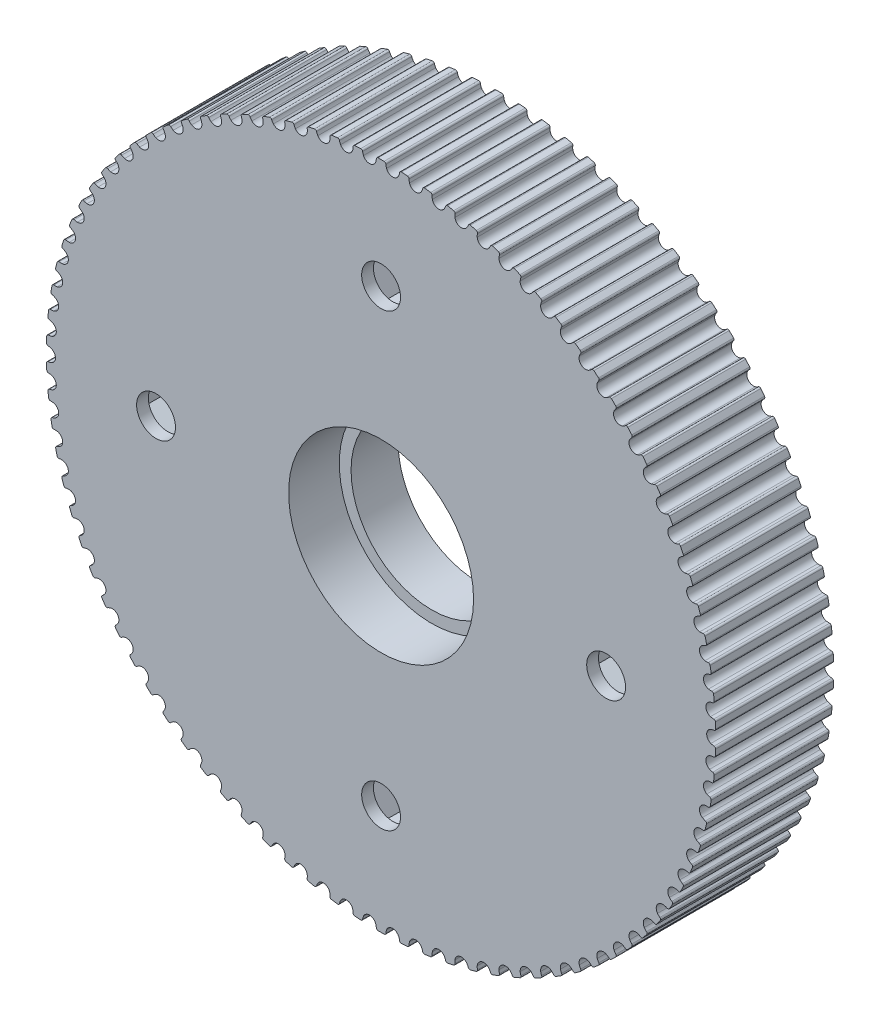
from build123d import *

# Parameters (mm, degrees)
EXTRUDE_1_DEPTH     = 10
SKETCH_7_R          = 6.85
SKETCH_7_R_2        = 1.65
CUT_EXTRUDE_2_DEPTH = 42.389606088
SKETCH_8_R          = 7.85
CUT_EXTRUDE_3_DEPTH = 4.3
CUT_EXTRUDE_4_DEPTH = 9


with BuildPart() as part:
    # 草图5 → 凸台-拉伸1 (new body)
    with BuildSketch(Plane.XY):
        with BuildLine():
            Line((-10.005707242, 26.144812388), (-10.005672259, 26.138581073))
            ThreePointArc((-10.005672259, 26.138581073), (-10.355657709, 25.622834978), (-10.964209319, 25.757552411))
            ThreePointArc((-10.964209319, 25.757552411), (-11.052436124, 25.865080775), (-11.124889477, 25.983810847))
            ThreePointArc((-11.124889477, 25.983810847), (-11.207844336, 26.056115388), (-11.317822781, 26.052347527))
            ThreePointArc((-11.317822781, 26.052347527), (-11.553167651, 25.9488394), (-11.787565636, 25.843204533))
            ThreePointArc((-11.787565636, 25.843204533), (-11.863955647, 25.763995812), (-11.865730536, 25.653967156))
            ThreePointArc((-11.865730536, 25.653967156), (-11.825977654, 25.520677898), (-11.805103762, 25.383162085))
            ThreePointArc((-11.805103762, 25.383162085), (-11.803737806, 25.360716271), (-11.803282238, 25.338233546))
            ThreePointArc((-11.803282238, 25.338233546), (-12.135393298, 24.829956535), (-12.734257086, 24.929983729))
            ThreePointArc((-12.734257086, 24.929983729), (-12.829769774, 25.031095769), (-12.910328825, 25.144482529))
            ThreePointArc((-12.910328825, 25.144482529), (-12.99812532, 25.210824302), (-13.107573031, 25.19939391))
            ThreePointArc((-13.107573031, 25.19939391), (-13.33512425, 25.079721095), (-13.561582537, 24.957992773))
            ThreePointArc((-13.561582537, 24.957992773), (-13.632261144, 24.873648303), (-13.626356498, 24.763763861))
            ThreePointArc((-13.626356498, 24.763763861), (-13.577402664, 24.633572309), (-13.546987001, 24.497847567))
            ThreePointArc((-13.546987001, 24.497847567), (-13.542261923, 24.456263043), (-13.540683906, 24.414440693))
            ThreePointArc((-13.540683906, 24.414440693), (-13.855192132, 23.914252022), (-14.44226483, 23.980958671))
            ThreePointArc((-14.44226483, 23.980958671), (-14.544598074, 24.075161779), (-14.632870348, 24.18265282))
            ThreePointArc((-14.632870348, 24.18265282), (-14.725080743, 24.242708613), (-14.8334645, 24.223671379))
            ThreePointArc((-14.8334645, 24.223671379), (-15.052113463, 24.08841691), (-15.26952877, 23.951188181))
            ThreePointArc((-15.26952877, 23.951188181), (-15.334151635, 23.862118879), (-15.320596222, 23.752913998))
            ThreePointArc((-15.320596222, 23.752913998), (-15.262679933, 23.626454433), (-15.222870682, 23.493181998))
            ThreePointArc((-15.222870682, 23.493181998), (-15.212787545, 23.432814159), (-15.209412819, 23.371703138))
            ThreePointArc((-15.209412819, 23.371703138), (-15.506611214, 22.88021221), (-16.079911313, 22.915100794))
            ThreePointArc((-16.079911313, 22.915100794), (-16.188566555, 23.001936021), (-16.284121998, 23.103007656))
            ThreePointArc((-16.284121998, 23.103007656), (-16.380297053, 23.156484885), (-16.487088824, 23.129933556))
            ThreePointArc((-16.487088824, 23.129933556), (-16.695770293, 22.97975638), (-16.903083396, 22.827695808))
            ThreePointArc((-16.903083396, 22.827695808), (-16.961335683, 22.734335611), (-16.940195542, 22.626342325))
            ThreePointArc((-16.940195542, 22.626342325), (-16.873598961, 22.504230845), (-16.824590068, 22.374060009))
            ThreePointArc((-16.824590068, 22.374060009), (-16.807182604, 22.295426233), (-16.801339099, 22.215100995))
            ThreePointArc((-16.801339099, 22.215100995), (-17.081541753, 21.732906616), (-17.639218085, 21.737602849))
            ThreePointArc((-17.639218085, 21.737602849), (-17.753665967, 21.816647143), (-17.856039043, 21.910806962))
            ThreePointArc((-17.856039043, 21.910806962), (-17.955710203, 21.95744509), (-18.060389707, 21.923509021))
            ThreePointArc((-18.060389707, 21.923509021), (-18.258087009, 21.759140786), (-18.454287898, 21.592989195))
            ThreePointArc((-18.454287898, 21.592989195), (-18.505885806, 21.495792944), (-18.477263931, 21.389537387))
            ThreePointArc((-18.477263931, 21.389537387), (-18.402311509, 21.272368907), (-18.344341741, 21.145933848))
            ThreePointArc((-18.344341741, 21.145933848), (-18.317688385, 21.049710704), (-18.308707038, 20.950269113))
            ThreePointArc((-18.308707038, 20.950269113), (-18.572248749, 20.477958763), (-19.112588357, 20.454201487))
            ThreePointArc((-19.112588357, 20.454201487), (-19.232271302, 20.525069753), (-19.340963259, 20.611859019))
            ThreePointArc((-19.340963259, 20.611859019), (-19.443644937, 20.65143083), (-19.545702186, 20.610275354))
            ThreePointArc((-19.545702186, 20.610275354), (-19.731452159, 20.432516845), (-19.915584963, 20.253083709))
            ThreePointArc((-19.915584963, 20.253083709), (-19.960277115, 20.152524935), (-19.924312948, 20.048524772))
            ThreePointArc((-19.924312948, 20.048524772), (-19.841369847, 19.936870125), (-19.774721627, 19.814786822))
            ThreePointArc((-19.774721627, 19.814786822), (-19.736957321, 19.701806415), (-19.724172893, 19.583369624))
            ThreePointArc((-19.724172893, 19.583369624), (-19.97140876, 19.121518741), (-20.492844022, 19.071149312))
            ThreePointArc((-20.492844022, 19.071149312), (-20.617178945, 19.133496286), (-20.731660247, 19.21249217))
            ThreePointArc((-20.731660247, 19.21249217), (-20.836852188, 19.244804874), (-20.935789969, 19.196630498))
            ThreePointArc((-20.935789969, 19.196630498), (-21.108687658, 19.006347736), (-21.279855301, 18.814507235))
            ThreePointArc((-21.279855301, 18.814507235), (-21.317423959, 18.711075851), (-21.274292715, 18.60983776))
            ThreePointArc((-21.274292715, 18.60983776), (-21.183763024, 18.504240916), (-21.108761055, 18.387104147))
            ThreePointArc((-21.108761055, 18.387104147), (-21.058088772, 18.258349622), (-21.040840656, 18.121061929))
            ThreePointArc((-21.040840656, 18.121061929), (-21.272145641, 17.670233206), (-21.773260611, 17.595184414))
            ThreePointArc((-21.773260611, 17.595184414), (-21.901641765, 17.648706349), (-22.021354671, 17.71952399))
            ThreePointArc((-22.021354671, 17.71952399), (-22.12854439, 17.744420164), (-22.22388069, 17.689461587))
            ThreePointArc((-22.22388069, 17.689461587), (-22.383083754, 17.487581612), (-22.540452324, 17.284268373))
            ThreePointArc((-22.540452324, 17.284268373), (-22.570714458, 17.178468285), (-22.520626267, 17.080485489))
            ThreePointArc((-22.520626267, 17.080485489), (-22.422951039, 16.981460906), (-22.339960723, 16.869841349))
            ThreePointArc((-22.339960723, 16.869841349), (-22.274662626, 16.726441571), (-22.252295656, 16.570470241))
            ThreePointArc((-22.252295656, 16.570470241), (-22.468064131, 16.131212943), (-22.947600063, 16.033497547))
            ThreePointArc((-22.947600063, 16.033497547), (-23.079401989, 16.077933688), (-23.203763269, 16.140228071))
            ThreePointArc((-23.203763269, 16.140228071), (-23.312428548, 16.157586423), (-23.403698897, 16.096111398))
            ThreePointArc((-23.403698897, 16.096111398), (-23.548431715, 15.883617748), (-23.691234529, 15.669822293))
            ThreePointArc((-23.691234529, 15.669822293), (-23.714042705, 15.562168949), (-23.657241592, 15.46791881))
            ThreePointArc((-23.657241592, 15.46791881), (-23.55289669, 15.375948926), (-23.462322347, 15.27039038))
            ThreePointArc((-23.462322347, 15.27039038), (-23.38077056, 15.11361383), (-23.352635803, 14.939148888))
            ThreePointArc((-23.352635803, 14.939148888), (-23.553281071, 14.511998184), (-24.010141114, 14.393697092))
            ThreePointArc((-24.010141114, 14.393697092), (-24.144721685, 14.428830951), (-24.273125463, 14.482298584))
            ThreePointArc((-24.273125463, 14.482298584), (-24.382736897, 14.492034544), (-24.469496635, 14.424342572))
            ThreePointArc((-24.469496635, 14.424342572), (-24.599054084, 14.202270495), (-24.72659542, 13.979034415))
            ThreePointArc((-24.72659542, 13.979034415), (-24.741838519, 13.870052291), (-24.678601213, 13.779993985))
            ThreePointArc((-24.678601213, 13.779993985), (-24.568094995, 13.695526867), (-24.470377895, 13.596543603))
            ThreePointArc((-24.470377895, 13.596543603), (-24.371044799, 13.427791497), (-24.336500351, 13.235045502))
            ThreePointArc((-24.336500351, 13.235045502), (-24.522454138, 12.820521809), (-24.955707171, 12.68377199))
            ThreePointArc((-24.955707171, 12.68377199), (-25.092410725, 12.709432399), (-25.224231432, 12.753812793))
            ThreePointArc((-25.224231432, 12.753812793), (-25.334255003, 12.75587893), (-25.416081446, 12.682299798))
            ThreePointArc((-25.416081446, 12.682299798), (-25.529832334, 12.451731206), (-25.641490824, 12.220142084))
            ThreePointArc((-25.641490824, 12.220142084), (-25.649094583, 12.110362131), (-25.57972917, 12.024934414))
            ThreePointArc((-25.57972917, 12.024934414), (-25.463600012, 11.948381578), (-25.359216222, 11.856455833))
            ThreePointArc((-25.359216222, 11.856455833), (-25.240684245, 11.677254521), (-25.199096012, 11.466462305))
            ThreePointArc((-25.199096012, 11.466462305), (-25.370807943, 11.065070656), (-25.779691531, 10.912052827))
            ThreePointArc((-25.779691531, 10.912052827), (-25.917852061, 10.928114771), (-26.052447479, 10.963191708))
            ThreePointArc((-26.052447479, 10.963191708), (-26.162347165, 10.957577956), (-26.238841661, 10.878470135))
            ThreePointArc((-26.238841661, 10.878470135), (-26.336231806, 10.640528336), (-26.431463461, 10.401714451))
            ThreePointArc((-26.431463461, 10.401714451), (-26.431390835, 10.291671505), (-26.356235257, 10.211290572))
            ThreePointArc((-26.356235257, 10.211290572), (-26.235048928, 10.143024975), (-26.124506996, 10.058604602))
            ThreePointArc((-26.124506996, 10.058604602), (-25.985477837, 9.870597276), (-25.936220305, 9.642015657))
            ThreePointArc((-25.936220305, 9.642015657), (-26.094157358, 9.254245085), (-26.478079823, 9.087171239))
            ThreePointArc((-26.478079823, 9.087171239), (-26.617024226, 9.093556465), (-26.75373862, 9.119159055))
            ThreePointArc((-26.75373862, 9.119159055), (-26.862979001, 9.105892763), (-26.933768878, 9.021641659))
            ThreePointArc((-26.933768878, 9.021641659), (-27.014323804, 8.777485881), (-27.092664666, 8.53261071))
            ThreePointArc((-27.092664666, 8.53261071), (-27.084916008, 8.422840889), (-27.004336414, 8.347898348))
            ThreePointArc((-27.004336414, 8.347898348), (-26.878683321, 8.288252574), (-26.762521797, 8.21174886))
            ThreePointArc((-26.762521797, 8.21174886), (-26.601825035, 8.016686608), (-26.544282034, 7.770594077))
            ThreePointArc((-26.544282034, 7.770594077), (-26.68892797, 7.396917021), (-27.047469573, 7.218017866))
            ThreePointArc((-27.047469573, 7.218017866), (-27.186520925, 7.214695267), (-27.324688236, 7.230698776))
            ThreePointArc((-27.324688236, 7.230698776), (-27.432737103, 7.209844577), (-27.497477479, 7.120860652))
            ThreePointArc((-27.497477479, 7.120860652), (-27.560804732, 6.871680397), (-27.62187313, 6.621936947))
            ThreePointArc((-27.62187313, 6.621936947), (-27.606486193, 6.512975039), (-27.52087516, 6.443836003))
            ThreePointArc((-27.52087516, 6.443836003), (-27.391367473, 6.39310064), (-27.270152282, 6.324886303))
            ThreePointArc((-27.270152282, 6.324886303), (-27.086753331, 6.124618562), (-27.020318787, 5.861314945))
            ThreePointArc((-27.020318787, 5.861314945), (-27.152173558, 5.502186674), (-27.48508677, 5.313699037))
            ThreePointArc((-27.48508677, 5.313699037), (-27.623567627, 5.300684799), (-27.762514718, 5.30701126))
            ThreePointArc((-27.762514718, 5.30701126), (-27.868845668, 5.278670753), (-27.927221136, 5.185387527))
            ThreePointArc((-27.927221136, 5.185387527), (-27.973012191, 4.932396778), (-28.016510607, 4.679001774))
            ThreePointArc((-28.016510607, 4.679001774), (-27.993560353, 4.57137863), (-27.903334968, 4.508379937))
            ThreePointArc((-27.903334968, 4.508379937), (-27.770603635, 4.466802162), (-27.644925327, 4.407209536))
            ThreePointArc((-27.644925327, 4.407209536), (-27.437932688, 4.203673984), (-27.36201136, 3.923480076))
            ThreePointArc((-27.36201136, 3.923480076), (-27.481590504, 3.579338131), (-27.788799389, 3.383492399))
            ThreePointArc((-27.788799389, 3.383492399), (-27.926035087, 3.360849927), (-28.065085021, 3.357468518))
            ThreePointArc((-28.065085021, 3.357468518), (-28.16918002, 3.321779774), (-28.220906179, 3.224651716))
            ThreePointArc((-28.220906179, 3.224651716), (-28.248937946, 2.969083016), (-28.274654461, 2.713270974))
            ThreePointArc((-28.274654461, 2.713270974), (-28.244252701, 2.607510924), (-28.149852535, 2.550959497))
            ThreePointArc((-28.149852535, 2.550959497), (-28.014544209, 2.518741873), (-27.885015076, 2.468061287))
            ThreePointArc((-27.885015076, 2.468061287), (-27.653686855, 2.263273231), (-27.567695058, 1.966530405))
            ThreePointArc((-27.567695058, 1.966530405), (-27.675529068, 1.637794071), (-27.957127768, 1.436801727))
            ThreePointArc((-27.957127768, 1.436801727), (-28.092449707, 1.404641332), (-28.230925048, 1.391568527))
            ThreePointArc((-28.230925048, 1.391568527), (-28.332276956, 1.348705419), (-28.377101802, 1.248205724))
            ThreePointArc((-28.377101802, 1.248205724), (-28.387237714, 0.99130418), (-28.395047038, 0.73432139))
            ThreePointArc((-28.395047038, 0.73432139), (-28.357341888, 0.630939685), (-28.259226847, 0.581111038))
            ThreePointArc((-28.259226847, 0.581111038), (-28.122000739, 0.558410527), (-27.989251833, 0.516888892))
            ThreePointArc((-27.989251833, 0.516888892), (-27.733001492, 0.312930204), (-27.636367813, -4e-09))
            ThreePointArc((-27.636367813, -4e-09), (-27.733001492, -0.312930213), (-27.989251833, -0.5168889))
            ThreePointArc((-27.989251833, -0.5168889), (-28.122000739, -0.558410535), (-28.259226847, -0.581111046))
            ThreePointArc((-28.259226847, -0.581111046), (-28.357341888, -0.630939694), (-28.395047039, -0.734321399))
            ThreePointArc((-28.395047039, -0.734321399), (-28.387237715, -0.991304189), (-28.377101803, -1.248205733))
            ThreePointArc((-28.377101803, -1.248205733), (-28.332276957, -1.348705427), (-28.230925049, -1.391568535))
            ThreePointArc((-28.230925049, -1.391568535), (-28.092449708, -1.40464134), (-27.957127769, -1.436801734))
            ThreePointArc((-27.957127769, -1.436801734), (-27.675529068, -1.637794079), (-27.567695058, -1.966530413))
            ThreePointArc((-27.567695058, -1.966530413), (-27.653686854, -2.263273239), (-27.885015075, -2.468061295))
            ThreePointArc((-27.885015075, -2.468061295), (-28.014544209, -2.518741881), (-28.149852534, -2.550959504))
            ThreePointArc((-28.149852534, -2.550959504), (-28.2442527, -2.607510932), (-28.27465446, -2.713270983))
            ThreePointArc((-28.27465446, -2.713270983), (-28.248937945, -2.969083025), (-28.220906178, -3.224651724))
            ThreePointArc((-28.220906178, -3.224651724), (-28.169180019, -3.321779782), (-28.06508502, -3.357468527))
            ThreePointArc((-28.06508502, -3.357468527), (-27.926035086, -3.360849935), (-27.788799388, -3.383492407))
            ThreePointArc((-27.788799388, -3.383492407), (-27.481590503, -3.579338139), (-27.362011359, -3.923480083))
            ThreePointArc((-27.362011359, -3.923480083), (-27.437932687, -4.203673992), (-27.644925327, -4.407209544))
            ThreePointArc((-27.644925327, -4.407209544), (-27.770603635, -4.46680217), (-27.903334968, -4.508379945))
            ThreePointArc((-27.903334968, -4.508379945), (-27.993560353, -4.571378638), (-28.016510607, -4.679001782))
            ThreePointArc((-28.016510607, -4.679001782), (-27.973012191, -4.932396785), (-27.927221136, -5.185387535))
            ThreePointArc((-27.927221136, -5.185387535), (-27.868845669, -5.278670761), (-27.762514718, -5.307011269))
            ThreePointArc((-27.762514718, -5.307011269), (-27.623567627, -5.300684807), (-27.48508677, -5.313699045))
            ThreePointArc((-27.48508677, -5.313699045), (-27.152173558, -5.502186682), (-27.020318787, -5.861314953))
            ThreePointArc((-27.020318787, -5.861314953), (-27.086753331, -6.124618571), (-27.270152282, -6.324886311))
            ThreePointArc((-27.270152282, -6.324886311), (-27.391367473, -6.393100648), (-27.520875161, -6.443836012))
            ThreePointArc((-27.520875161, -6.443836012), (-27.606486194, -6.512975048), (-27.621873131, -6.621936956))
            ThreePointArc((-27.621873131, -6.621936956), (-27.560804733, -6.871680405), (-27.49747748, -7.120860659))
            ThreePointArc((-27.49747748, -7.120860659), (-27.432737103, -7.209844584), (-27.324688236, -7.230698784))
            ThreePointArc((-27.324688236, -7.230698784), (-27.186520925, -7.214695274), (-27.047469573, -7.218017874))
            ThreePointArc((-27.047469573, -7.218017874), (-26.68892797, -7.396917029), (-26.544282034, -7.770594085))
            ThreePointArc((-26.544282034, -7.770594085), (-26.601825035, -8.016686616), (-26.762521796, -8.211748867))
            ThreePointArc((-26.762521796, -8.211748867), (-26.87868332, -8.288252582), (-27.004336413, -8.347898355))
            ThreePointArc((-27.004336413, -8.347898355), (-27.084916007, -8.422840896), (-27.092664664, -8.532610717))
            ThreePointArc((-27.092664664, -8.532610717), (-27.014323803, -8.777485889), (-26.933768877, -9.021641667))
            ThreePointArc((-26.933768877, -9.021641667), (-26.862979, -9.105892771), (-26.753738619, -9.119159063))
            ThreePointArc((-26.753738619, -9.119159063), (-26.617024225, -9.093556473), (-26.478079822, -9.087171247))
            ThreePointArc((-26.478079822, -9.087171247), (-26.094157357, -9.254245093), (-25.936220303, -9.642015665))
            ThreePointArc((-25.936220303, -9.642015665), (-25.985477836, -9.870597284), (-26.124506994, -10.058604609))
            ThreePointArc((-26.124506994, -10.058604609), (-26.235048926, -10.143024983), (-26.356235256, -10.21129058))
            ThreePointArc((-26.356235256, -10.21129058), (-26.431390833, -10.291671512), (-26.43146346, -10.401714458))
            ThreePointArc((-26.43146346, -10.401714458), (-26.336231804, -10.640528343), (-26.23884166, -10.878470143))
            ThreePointArc((-26.23884166, -10.878470143), (-26.162347163, -10.957577963), (-26.052447477, -10.963191716))
            ThreePointArc((-26.052447477, -10.963191716), (-25.917852059, -10.928114778), (-25.779691529, -10.912052835))
            ThreePointArc((-25.779691529, -10.912052835), (-25.370807941, -11.065070663), (-25.19909601, -11.466462313))
            ThreePointArc((-25.19909601, -11.466462313), (-25.240684243, -11.677254528), (-25.35921622, -11.85645584))
            ThreePointArc((-25.35921622, -11.85645584), (-25.463600009, -11.948381585), (-25.579729168, -12.024934421))
            ThreePointArc((-25.579729168, -12.024934421), (-25.649094581, -12.110362138), (-25.641490822, -12.220142091))
            ThreePointArc((-25.641490822, -12.220142091), (-25.529832332, -12.451731214), (-25.416081444, -12.682299805))
            ThreePointArc((-25.416081444, -12.682299805), (-25.334255002, -12.755878937), (-25.22423143, -12.7538128))
            ThreePointArc((-25.22423143, -12.7538128), (-25.092410723, -12.709432406), (-24.955707169, -12.683771997))
            ThreePointArc((-24.955707169, -12.683771997), (-24.522454137, -12.820521815), (-24.33650035, -13.235045509))
            ThreePointArc((-24.33650035, -13.235045509), (-24.371044798, -13.427791503), (-24.470377894, -13.59654361))
            ThreePointArc((-24.470377894, -13.59654361), (-24.568094995, -13.695526873), (-24.678601212, -13.779993991))
            ThreePointArc((-24.678601212, -13.779993991), (-24.741838518, -13.870052297), (-24.726595419, -13.979034421))
            ThreePointArc((-24.726595419, -13.979034421), (-24.599054082, -14.202270501), (-24.469496634, -14.424342579))
            ThreePointArc((-24.469496634, -14.424342579), (-24.382736895, -14.492034551), (-24.273125462, -14.48229859))
            ThreePointArc((-24.273125462, -14.48229859), (-24.144721683, -14.428830957), (-24.010141112, -14.393697098))
            ThreePointArc((-24.010141112, -14.393697098), (-23.553281069, -14.51199819), (-23.352635801, -14.939148894))
            ThreePointArc((-23.352635801, -14.939148894), (-23.380770558, -15.113613836), (-23.462322345, -15.270390386))
            ThreePointArc((-23.462322345, -15.270390386), (-23.552896688, -15.375948932), (-23.65724159, -15.467918816))
            ThreePointArc((-23.65724159, -15.467918816), (-23.714042704, -15.562168956), (-23.691234528, -15.6698223))
            ThreePointArc((-23.691234528, -15.6698223), (-23.548431714, -15.883617755), (-23.403698896, -16.096111405))
            ThreePointArc((-23.403698896, -16.096111405), (-23.312428547, -16.15758643), (-23.203763268, -16.140228078))
            ThreePointArc((-23.203763268, -16.140228078), (-23.079401987, -16.077933695), (-22.947600062, -16.033497554))
            ThreePointArc((-22.947600062, -16.033497554), (-22.468064131, -16.13121295), (-22.252295655, -16.570470247))
            ThreePointArc((-22.252295655, -16.570470247), (-22.274662626, -16.726441578), (-22.339960722, -16.869841355))
            ThreePointArc((-22.339960722, -16.869841355), (-22.422951038, -16.981460912), (-22.520626267, -17.080485495))
            ThreePointArc((-22.520626267, -17.080485495), (-22.570714458, -17.178468291), (-22.540452324, -17.284268379))
            ThreePointArc((-22.540452324, -17.284268379), (-22.383083754, -17.487581618), (-22.22388069, -17.689461594))
            ThreePointArc((-22.22388069, -17.689461594), (-22.12854439, -17.744420171), (-22.021354671, -17.719523997))
            ThreePointArc((-22.021354671, -17.719523997), (-21.901641765, -17.648706355), (-21.773260611, -17.595184421))
            ThreePointArc((-21.773260611, -17.595184421), (-21.272145642, -17.670233212), (-21.040840657, -18.121061935))
            ThreePointArc((-21.040840657, -18.121061935), (-21.058088772, -18.258349627), (-21.108761055, -18.387104153))
            ThreePointArc((-21.108761055, -18.387104153), (-21.183763025, -18.504240922), (-21.274292715, -18.609837766))
            ThreePointArc((-21.274292715, -18.609837766), (-21.31742396, -18.711075857), (-21.279855301, -18.814507241))
            ThreePointArc((-21.279855301, -18.814507241), (-21.108687658, -19.006347742), (-20.93578997, -19.196630504))
            ThreePointArc((-20.93578997, -19.196630504), (-20.836852188, -19.24480488), (-20.731660248, -19.212492176))
            ThreePointArc((-20.731660248, -19.212492176), (-20.617178946, -19.133496292), (-20.492844023, -19.071149318))
            ThreePointArc((-20.492844023, -19.071149318), (-19.97140876, -19.121518747), (-19.724172894, -19.583369631))
            ThreePointArc((-19.724172894, -19.583369631), (-19.736957322, -19.701806421), (-19.774721627, -19.814786828))
            ThreePointArc((-19.774721627, -19.814786828), (-19.841369847, -19.936870131), (-19.924312948, -20.048524778))
            ThreePointArc((-19.924312948, -20.048524778), (-19.960277115, -20.152524942), (-19.915584963, -20.253083715))
            ThreePointArc((-19.915584963, -20.253083715), (-19.73145216, -20.432516851), (-19.545702187, -20.61027536))
            ThreePointArc((-19.545702187, -20.61027536), (-19.443644938, -20.651430836), (-19.34096326, -20.611859025))
            ThreePointArc((-19.34096326, -20.611859025), (-19.232271303, -20.525069759), (-19.112588358, -20.454201493))
            ThreePointArc((-19.112588358, -20.454201493), (-18.572248751, -20.477958769), (-18.308707039, -20.950269118))
            ThreePointArc((-18.308707039, -20.950269118), (-18.317688386, -21.04971071), (-18.344341743, -21.145933853))
            ThreePointArc((-18.344341743, -21.145933853), (-18.402311511, -21.272368913), (-18.477263932, -21.389537392))
            ThreePointArc((-18.477263932, -21.389537392), (-18.505885807, -21.49579295), (-18.454287899, -21.5929892))
            ThreePointArc((-18.454287899, -21.5929892), (-18.25808701, -21.759140792), (-18.060389708, -21.923509027))
            ThreePointArc((-18.060389708, -21.923509027), (-17.955710204, -21.957445096), (-17.856039044, -21.910806968))
            ThreePointArc((-17.856039044, -21.910806968), (-17.753665968, -21.816647149), (-17.639218086, -21.737602855))
            ThreePointArc((-17.639218086, -21.737602855), (-17.081541754, -21.732906622), (-16.8013391, -22.215101001))
            ThreePointArc((-16.8013391, -22.215101001), (-16.807182605, -22.295426239), (-16.824590069, -22.374060015))
            ThreePointArc((-16.824590069, -22.374060015), (-16.873598961, -22.504230851), (-16.940195543, -22.626342331))
            ThreePointArc((-16.940195543, -22.626342331), (-16.961335684, -22.734335616), (-16.903083397, -22.827695814))
            ThreePointArc((-16.903083397, -22.827695814), (-16.695770295, -22.979756386), (-16.487088825, -23.129933562))
            ThreePointArc((-16.487088825, -23.129933562), (-16.380297055, -23.156484891), (-16.284121999, -23.103007662))
            ThreePointArc((-16.284121999, -23.103007662), (-16.188566556, -23.001936027), (-16.079911315, -22.9151008))
            ThreePointArc((-16.079911315, -22.9151008), (-15.506611215, -22.880212216), (-15.209412821, -23.371703144))
            ThreePointArc((-15.209412821, -23.371703144), (-15.212787547, -23.432814165), (-15.222870684, -23.493182005))
            ThreePointArc((-15.222870684, -23.493182005), (-15.262679934, -23.626454439), (-15.320596223, -23.752914004))
            ThreePointArc((-15.320596223, -23.752914004), (-15.334151637, -23.862118885), (-15.269528772, -23.951188187))
            ThreePointArc((-15.269528772, -23.951188187), (-15.052113465, -24.088416917), (-14.833464502, -24.223671385))
            ThreePointArc((-14.833464502, -24.223671385), (-14.725080745, -24.24270862), (-14.63287035, -24.182652826))
            ThreePointArc((-14.63287035, -24.182652826), (-14.544598076, -24.075161786), (-14.442264832, -23.980958678))
            ThreePointArc((-14.442264832, -23.980958678), (-13.855192134, -23.914252029), (-13.540683908, -24.414440699))
            ThreePointArc((-13.540683908, -24.414440699), (-13.542261926, -24.456263049), (-13.546987004, -24.497847573))
            ThreePointArc((-13.546987004, -24.497847573), (-13.577402666, -24.633572316), (-13.626356501, -24.763763868))
            ThreePointArc((-13.626356501, -24.763763868), (-13.632261146, -24.87364831), (-13.561582538, -24.95799278))
            ThreePointArc((-13.561582538, -24.95799278), (-13.335124252, -25.079721102), (-13.107573032, -25.199393916))
            ThreePointArc((-13.107573032, -25.199393916), (-12.998125322, -25.210824308), (-12.910328827, -25.144482536))
            ThreePointArc((-12.910328827, -25.144482536), (-12.829769776, -25.031095775), (-12.734257088, -24.929983736))
            ThreePointArc((-12.734257088, -24.929983736), (-12.135393299, -24.829956542), (-11.80328224, -25.338233554))
            ThreePointArc((-11.80328224, -25.338233554), (-11.803737808, -25.360716277), (-11.805103763, -25.383162092))
            ThreePointArc((-11.805103763, -25.383162092), (-11.825977655, -25.520677905), (-11.865730538, -25.653967163))
            ThreePointArc((-11.865730538, -25.653967163), (-11.863955649, -25.763995819), (-11.787565638, -25.84320454))
            ThreePointArc((-11.787565638, -25.84320454), (-11.553167653, -25.948839407), (-11.317822784, -26.052347534))
            ThreePointArc((-11.317822784, -26.052347534), (-11.207844338, -26.056115395), (-11.12488948, -25.983810854))
            ThreePointArc((-11.12488948, -25.983810854), (-11.052436127, -25.865080782), (-10.964209322, -25.757552418))
            ThreePointArc((-10.964209322, -25.757552418), (-10.355657712, -25.622834986), (-10.005672262, -26.13858108))
            Line((-10.005672262, -26.13858108), (-10.005707245, -26.144812394))
            ThreePointArc((-10.005707245, -26.144812394), (-10.016937671, -26.283449315), (-10.047295928, -26.419186909))
            ThreePointArc((-10.047295928, -26.419186909), (-10.037850152, -26.52882373), (-9.956120903, -26.602510805))
            ThreePointArc((-9.956120903, -26.602510805), (-9.714925185, -26.691537573), (-9.472933242, -26.778376732))
            ThreePointArc((-9.472933242, -26.778376732), (-9.362959865, -26.774463706), (-9.28525079, -26.696548656))
            ThreePointArc((-9.28525079, -26.696548656), (-9.221256121, -26.573053715), (-9.140745032, -26.459632894))
            ThreePointArc((-9.140745032, -26.459632894), (-8.54010732, -26.2837477), (-8.157563927, -26.7790878))
            ThreePointArc((-8.157563927, -26.7790878), (-8.159096173, -26.918170403), (-8.179911904, -27.055695032))
            ThreePointArc((-8.179911904, -27.055695032), (-8.162841259, -27.164405879), (-8.076170947, -27.232212312))
            ThreePointArc((-8.076170947, -27.232212312), (-7.829352576, -27.304197253), (-7.581892519, -27.373944371))
            ThreePointArc((-7.581892519, -27.373944371), (-7.472459991, -27.362369522), (-7.400375291, -27.279223558))
            ThreePointArc((-7.400375291, -27.279223558), (-7.345151082, -27.151565402), (-7.27274795, -27.032804699))
            ThreePointArc((-7.27274795, -27.032804699), (-6.685842493, -26.815449584), (-6.269677777, -27.282898182))
            ThreePointArc((-6.269677777, -27.282898182), (-6.261504379, -27.42174887), (-6.27267617, -27.560390528))
            ThreePointArc((-6.27267617, -27.560390528), (-6.248063823, -27.667645773), (-6.156874698, -27.729241218))
            ThreePointArc((-6.156874698, -27.729241218), (-5.905636149, -27.783833628), (-5.653913579, -27.836148904))
            ThreePointArc((-5.653913579, -27.836148904), (-5.545555044, -27.816968624), (-5.479445907, -27.728996825))
            ThreePointArc((-5.479445907, -27.728996825), (-5.433261204, -27.597797392), (-5.36931877, -27.474275396))
            ThreePointArc((-5.36931877, -27.474275396), (-4.799004911, -27.216509293), (-4.351246386, -27.653789026))
            ThreePointArc((-4.351246386, -27.653789026), (-4.333407164, -27.791731334), (-4.334880588, -27.930814572))
            ThreePointArc((-4.334880588, -27.930814572), (-4.302846448, -28.036091679), (-4.207582774, -28.091176048))
            ThreePointArc((-4.207582774, -28.091176048), (-3.953148055, -28.128109958), (-3.69838934, -28.162738518))
            ThreePointArc((-3.69838934, -28.162738518), (-3.591632709, -28.136046251), (-3.531821214, -28.043677207))
            ThreePointArc((-3.531821214, -28.043677207), (-3.494901024, -27.909575687), (-3.43973081, -27.781894186))
            ThreePointArc((-3.43973081, -27.781894186), (-2.888787061, -27.484972904), (-2.411616161, -27.88995339))
            ThreePointArc((-2.411616161, -27.88995339), (-2.384198025, -28.026315276), (-2.375965904, -28.165162495))
            ThreePointArc((-2.375965904, -28.165162495), (-2.336666037, -28.267948563), (-2.237791929, -28.316253492))
            ThreePointArc((-2.237791929, -28.316253492), (-1.981400621, -28.335348964), (-1.724846919, -28.352122101))
            ThreePointArc((-1.724846919, -28.352122101), (-1.620212301, -28.318047889), (-1.566989842, -28.221731612))
            ThreePointArc((-1.566989842, -28.221731612), (-1.539514037, -28.085381335), (-1.493384826, -27.95416238))
            ThreePointArc((-1.493384826, -27.95416238), (-0.96449533, -27.61953249), (-0.460236784, -27.990240704))
            ThreePointArc((-0.460236784, -27.990240704), (-0.423373313, -28.124357827), (-0.405475752, -28.262292578))
            ThreePointArc((-0.405475752, -28.262292578), (-0.359101625, -28.362086845), (-0.257098788, -28.403376996))
            ThreePointArc((-0.257098788, -28.403376996), (-3e-09, -28.404540999), (0.257098781, -28.403376996))
            ThreePointArc((0.257098781, -28.403376996), (0.359101618, -28.362086845), (0.405475746, -28.262292578))
            ThreePointArc((0.405475746, -28.262292578), (0.423373307, -28.124357827), (0.460236778, -27.990240704))
            ThreePointArc((0.460236778, -27.990240704), (0.964495324, -27.619532491), (1.493384819, -27.954162381))
            ThreePointArc((1.493384819, -27.954162381), (1.53951403, -28.085381335), (1.566989835, -28.221731613))
            ThreePointArc((1.566989835, -28.221731613), (1.620212294, -28.31804789), (1.724846913, -28.352122102))
            ThreePointArc((1.724846913, -28.352122102), (1.981400614, -28.335348965), (2.237791923, -28.316253493))
            ThreePointArc((2.237791923, -28.316253493), (2.33666603, -28.267948564), (2.375965897, -28.165162496))
            ThreePointArc((2.375965897, -28.165162496), (2.375925478, -28.159971676), (2.375912005, -28.154780717))
            ThreePointArc((2.375912005, -28.154780717), (2.384878239, -28.021169061), (2.411616154, -27.889953391))
            ThreePointArc((2.411616154, -27.889953391), (2.888787055, -27.484972905), (3.439730803, -27.781894187))
            ThreePointArc((3.439730803, -27.781894187), (3.494901017, -27.909575688), (3.531821207, -28.043677208))
            ThreePointArc((3.531821207, -28.043677208), (3.591632703, -28.136046252), (3.698389333, -28.162738519))
            ThreePointArc((3.698389333, -28.162738519), (3.953148048, -28.128109959), (4.207582767, -28.091176049))
            ThreePointArc((4.207582767, -28.091176049), (4.299013481, -28.040726268), (4.335362667, -27.942830954))
            ThreePointArc((4.335362667, -27.942830954), (4.335242097, -27.93681793), (4.334880581, -27.930814573))
            ThreePointArc((4.334880581, -27.930814573), (4.332470474, -27.890792193), (4.331666674, -27.850705369))
            ThreePointArc((4.331666674, -27.850705369), (4.33657364, -27.751761685), (4.35124638, -27.653789027))
            ThreePointArc((4.35124638, -27.653789027), (4.799004905, -27.216509294), (5.369318764, -27.474275397))
            ThreePointArc((5.369318764, -27.474275397), (5.433261197, -27.597797393), (5.479445901, -27.728996826))
            ThreePointArc((5.479445901, -27.728996826), (5.545555037, -27.816968625), (5.653913573, -27.836148905))
            ThreePointArc((5.653913573, -27.836148905), (5.905636142, -27.783833629), (6.156874692, -27.729241219))
            ThreePointArc((6.156874692, -27.729241219), (6.241358766, -27.676676804), (6.274360688, -27.582807481))
            ThreePointArc((6.274360688, -27.582807481), (6.273938964, -27.571567404), (6.272676163, -27.560390529))
            ThreePointArc((6.272676163, -27.560390529), (6.264257493, -27.485878032), (6.261446, -27.410944184))
            ThreePointArc((6.261446, -27.410944184), (6.263506065, -27.34678902), (6.26967777, -27.282898183))
            ThreePointArc((6.26967777, -27.282898183), (6.685842485, -26.815449585), (7.272747942, -27.0328047))
            ThreePointArc((7.272747942, -27.0328047), (7.345151074, -27.151565403), (7.400375284, -27.279223559))
            ThreePointArc((7.400375284, -27.279223559), (7.472459984, -27.362369523), (7.581892512, -27.373944371))
            ThreePointArc((7.581892512, -27.373944371), (7.829352568, -27.304197253), (8.07617094, -27.232212313))
            ThreePointArc((8.07617094, -27.232212313), (8.153724235, -27.178132308), (8.183521437, -27.088403342))
            ThreePointArc((8.183521437, -27.088403342), (8.182616321, -27.071949906), (8.179911896, -27.055695032))
            ThreePointArc((8.179911896, -27.055695032), (8.161882396, -26.947329212), (8.155848289, -26.837639633))
            ThreePointArc((8.155848289, -26.837639633), (8.156277289, -26.808351152), (8.157563919, -26.7790878))
            ThreePointArc((8.157563919, -26.7790878), (8.540107313, -26.283747701), (9.140745024, -26.459632895))
            ThreePointArc((9.140745024, -26.459632895), (9.221256114, -26.573053716), (9.285250783, -26.696548656))
            ThreePointArc((9.285250783, -26.696548656), (9.362959857, -26.774463706), (9.472933234, -26.778376731))
            ThreePointArc((9.472933234, -26.778376731), (9.714925177, -26.691537573), (9.956120895, -26.602510805))
            ThreePointArc((9.956120895, -26.602510805), (10.026804748, -26.547506513), (10.053543678, -26.462027225))
            ThreePointArc((10.053543678, -26.462027225), (10.051973521, -26.440380475), (10.047295921, -26.419186909))
            ThreePointArc((10.047295921, -26.419186909), (10.016937664, -26.283449315), (10.005707238, -26.144812394))
            ThreePointArc((10.005707238, -26.144812394), (10.352765596, -25.623994041), (10.964209315, -25.757552418))
            ThreePointArc((10.964209315, -25.757552418), (11.05243612, -25.865080782), (11.124889473, -25.983810853))
            ThreePointArc((11.124889473, -25.983810853), (11.207844331, -26.056115395), (11.317822777, -26.052347534))
            ThreePointArc((11.317822777, -26.052347534), (11.553167646, -25.948839407), (11.78756563, -25.84320454))
            ThreePointArc((11.78756563, -25.84320454), (11.851486017, -25.78785624), (11.87531685, -25.706730772))
            ThreePointArc((11.87531685, -25.706730772), (11.872900813, -25.679917082), (11.86573053, -25.653967163))
            ThreePointArc((11.86573053, -25.653967163), (11.825977648, -25.520677904), (11.805103756, -25.383162091))
            ThreePointArc((11.805103756, -25.383162091), (12.114986246, -24.839402858), (12.73425708, -24.929983735))
            ThreePointArc((12.73425708, -24.929983735), (12.829769769, -25.031095775), (12.91032882, -25.144482535))
            ThreePointArc((12.91032882, -25.144482535), (12.998125315, -25.210824308), (13.107573026, -25.199393916))
            ThreePointArc((13.107573026, -25.199393916), (13.335124245, -25.079721102), (13.561582532, -24.95799278))
            ThreePointArc((13.561582532, -24.95799278), (13.618889003, -24.902866518), (13.639965458, -24.82619371))
            ThreePointArc((13.639965458, -24.82619371), (13.636523732, -24.794245748), (13.626356494, -24.763763868))
            ThreePointArc((13.626356494, -24.763763868), (13.577402659, -24.633572316), (13.546986997, -24.497847573))
            ThreePointArc((13.546986997, -24.497847573), (13.818183902, -23.9337966), (14.442264826, -23.980958678))
            ThreePointArc((14.442264826, -23.980958678), (14.54459807, -24.075161786), (14.632870344, -24.182652827))
            ThreePointArc((14.632870344, -24.182652827), (14.725080739, -24.24270862), (14.833464496, -24.223671385))
            ThreePointArc((14.833464496, -24.223671385), (15.052113459, -24.088416917), (15.269528766, -23.951188188))
            ThreePointArc((15.269528766, -23.951188188), (15.32041316, -23.896832663), (15.338892309, -23.824705929))
            ThreePointArc((15.338892309, -23.824705929), (15.334246335, -23.787662619), (15.320596217, -23.752914004))
            ThreePointArc((15.320596217, -23.752914004), (15.262679928, -23.626454439), (15.222870677, -23.493182005))
            ThreePointArc((15.222870677, -23.493182005), (15.454060753, -22.911587292), (16.079911308, -22.9151008))
            ThreePointArc((16.079911308, -22.9151008), (16.18856655, -23.001936028), (16.284121993, -23.103007663))
            ThreePointArc((16.284121993, -23.103007663), (16.380297048, -23.156484892), (16.487088819, -23.129933562))
            ThreePointArc((16.487088819, -23.129933562), (16.695770289, -22.979756386), (16.903083391, -22.827695814))
            ThreePointArc((16.903083391, -22.827695814), (16.947778322, -22.774639359), (16.963820403, -22.707146575))
            ThreePointArc((16.963820403, -22.707146575), (16.957793092, -22.665053048), (16.940195536, -22.626342331))
            ThreePointArc((16.940195536, -22.626342331), (16.873598955, -22.504230851), (16.824590062, -22.374060015))
            ThreePointArc((16.824590062, -22.374060015), (17.014646975, -21.777755032), (17.639218079, -21.737602855))
            ThreePointArc((17.639218079, -21.737602855), (17.753665961, -21.816647149), (17.856039037, -21.910806968))
            ThreePointArc((17.856039037, -21.910806968), (17.955710198, -21.957445096), (18.060389701, -21.923509028))
            ThreePointArc((18.060389701, -21.923509028), (18.258087003, -21.759140792), (18.454287892, -21.592989201))
            ThreePointArc((18.454287892, -21.592989201), (18.493065035, -21.54173689), (18.506833255, -21.478960285))
            ThreePointArc((18.506833255, -21.478960285), (18.499249196, -21.431867826), (18.477263926, -21.389537393))
            ThreePointArc((18.477263926, -21.389537393), (18.402311504, -21.272368913), (18.344341736, -21.145933854))
            ThreePointArc((18.344341736, -21.145933854), (18.492339546, -20.537823741), (19.112588352, -20.454201494))
            ThreePointArc((19.112588352, -20.454201494), (19.232271296, -20.525069759), (19.340963253, -20.611859025))
            ThreePointArc((19.340963253, -20.611859025), (19.443644931, -20.651430836), (19.545702181, -20.610275361))
            ThreePointArc((19.545702181, -20.610275361), (19.731452153, -20.432516852), (19.915584957, -20.253083715))
            ThreePointArc((19.915584957, -20.253083715), (19.948753123, -20.204114603), (19.96041346, -20.14613066))
            ThreePointArc((19.96041346, -20.14613066), (19.951099142, -20.094096643), (19.924312942, -20.048524779))
            ThreePointArc((19.924312942, -20.048524779), (19.841369841, -19.936870132), (19.77472162, -19.814786829))
            ThreePointArc((19.77472162, -19.814786829), (19.879939298, -19.197834236), (20.492844016, -19.071149319))
            ThreePointArc((20.492844016, -19.071149319), (20.617178939, -19.133496293), (20.731660241, -19.212492177))
            ThreePointArc((20.731660241, -19.212492177), (20.836852182, -19.244804882), (20.935789963, -19.196630505))
            ThreePointArc((20.935789963, -19.196630505), (21.108687652, -19.006347744), (21.279855295, -18.814507242))
            ThreePointArc((21.279855295, -18.814507242), (21.307758323, -18.768271748), (21.317479322, -18.715151111))
            ThreePointArc((21.317479322, -18.715151111), (21.306263341, -18.658238933), (21.274292709, -18.609837767))
            ThreePointArc((21.274292709, -18.609837767), (21.183763018, -18.504240924), (21.108761049, -18.387104154))
            ThreePointArc((21.108761049, -18.387104154), (21.170685985, -17.764314812), (21.773260605, -17.595184422))
            ThreePointArc((21.773260605, -17.595184422), (21.901641759, -17.648706356), (22.021354664, -17.719523998))
            ThreePointArc((22.021354664, -17.719523998), (22.128544383, -17.744420172), (22.223880683, -17.689461595))
            ThreePointArc((22.223880683, -17.689461595), (22.383083747, -17.487581619), (22.540452318, -17.28426838))
            ThreePointArc((22.540452318, -17.28426838), (22.563466783, -17.241185838), (22.571419354, -17.192993228))
            ThreePointArc((22.571419354, -17.192993228), (22.558132623, -17.131272227), (22.52062626, -17.080485496))
            ThreePointArc((22.52062626, -17.080485496), (22.422951032, -16.981460914), (22.339960715, -16.869841356))
            ThreePointArc((22.339960715, -16.869841356), (22.358291217, -16.244249433), (22.947600055, -16.033497555))
            ThreePointArc((22.947600055, -16.033497555), (23.079401981, -16.077933696), (23.203763261, -16.140228079))
            ThreePointArc((23.203763261, -16.140228079), (23.31242854, -16.157586431), (23.403698889, -16.096111406))
            ThreePointArc((23.403698889, -16.096111406), (23.548431707, -15.883617756), (23.691234521, -15.669822301))
            ThreePointArc((23.691234521, -15.669822301), (23.709767279, -15.630278679), (23.716124483, -15.587072811))
            ThreePointArc((23.716124483, -15.587072811), (23.700600438, -15.520618184), (23.657241584, -15.467918818))
            ThreePointArc((23.657241584, -15.467918818), (23.552896682, -15.375948934), (23.462322339, -15.270390388))
            ThreePointArc((23.462322339, -15.270390388), (23.436969102, -14.645043704), (24.010141106, -14.3936971))
            ThreePointArc((24.010141106, -14.3936971), (24.144721677, -14.428830959), (24.273125455, -14.482298592))
            ThreePointArc((24.273125455, -14.482298592), (24.382736889, -14.492034552), (24.469496628, -14.42434258))
            ThreePointArc((24.469496628, -14.42434258), (24.599054076, -14.202270503), (24.726595412, -13.979034422))
            ThreePointArc((24.726595412, -13.979034422), (24.741080979, -13.943380227), (24.746017823, -13.905213739))
            ThreePointArc((24.746017823, -13.905213739), (24.728092627, -13.834106452), (24.678601206, -13.779993993))
            ThreePointArc((24.678601206, -13.779993993), (24.568094988, -13.695526875), (24.470377888, -13.596543611))
            ThreePointArc((24.470377888, -13.596543611), (24.40146443, -12.974488793), (24.955707163, -12.683771999))
            ThreePointArc((24.955707163, -12.683771999), (25.092410717, -12.709432408), (25.224231424, -12.753812802))
            ThreePointArc((25.224231424, -12.753812802), (25.334254996, -12.755878939), (25.416081438, -12.682299807))
            ThreePointArc((25.416081438, -12.682299807), (25.529832326, -12.451731216), (25.641490816, -12.220142093))
            ThreePointArc((25.641490816, -12.220142093), (25.652388615, -12.188690473), (25.656081837, -12.155609866))
            ThreePointArc((25.656081837, -12.155609866), (25.635594575, -12.079936551), (25.579729162, -12.024934423))
            ThreePointArc((25.579729162, -12.024934423), (25.463600003, -11.948381587), (25.359216213, -11.856455842))
            ThreePointArc((25.359216213, -11.856455842), (25.247078275, -11.240723478), (25.779691521, -10.912052837))
            ThreePointArc((25.779691521, -10.912052837), (25.917852052, -10.92811478), (26.05244747, -10.963191718))
            ThreePointArc((26.05244747, -10.963191718), (26.162347157, -10.957577965), (26.238841653, -10.878470145))
            ThreePointArc((26.238841653, -10.878470145), (26.336231798, -10.640528345), (26.431463453, -10.40171446))
            ThreePointArc((26.431463453, -10.40171446), (26.439254932, -10.374739505), (26.441882783, -10.346785084))
            ThreePointArc((26.441882783, -10.346785084), (26.418675665, -10.266637938), (26.356235249, -10.211290582))
            ThreePointArc((26.356235249, -10.211290582), (26.235048919, -10.143024985), (26.124506987, -10.058604611))
            ThreePointArc((26.124506987, -10.058604611), (25.969690892, -9.452194487), (26.478079816, -9.087171249))
            ThreePointArc((26.478079816, -9.087171249), (26.617024219, -9.093556475), (26.753738613, -9.119159065))
            ThreePointArc((26.753738613, -9.119159065), (26.862978993, -9.105892773), (26.933768871, -9.021641669))
            ThreePointArc((26.933768871, -9.021641669), (27.014323797, -8.777485891), (27.092664658, -8.53261072))
            ThreePointArc((27.092664658, -8.53261072), (27.097850288, -8.510345983), (27.099592319, -8.487551803))
            ThreePointArc((27.099592319, -8.487551803), (27.073510867, -8.403028473), (27.004336407, -8.347898358))
            ThreePointArc((27.004336407, -8.347898358), (26.878683314, -8.288252584), (26.762521789, -8.21174887))
            ThreePointArc((26.762521789, -8.21174887), (26.565781786, -7.617615355), (27.047469566, -7.218017877))
            ThreePointArc((27.047469566, -7.218017877), (27.186520918, -7.214695277), (27.324688229, -7.230698787))
            ThreePointArc((27.324688229, -7.230698787), (27.432737096, -7.209844587), (27.497477472, -7.120860662))
            ThreePointArc((27.497477472, -7.120860662), (27.560804725, -6.871680408), (27.621873123, -6.621936958))
            ThreePointArc((27.621873123, -6.621936958), (27.62496931, -6.60457419), (27.62600615, -6.586968025))
            ThreePointArc((27.62600615, -6.586968025), (27.596899389, -6.498171489), (27.520875153, -6.443836014))
            ThreePointArc((27.520875153, -6.443836014), (27.391367466, -6.393100651), (27.270152275, -6.324886314))
            ThreePointArc((27.270152275, -6.324886314), (27.032446862, -5.745923968), (27.485086763, -5.313699048))
            ThreePointArc((27.485086763, -5.313699048), (27.62356762, -5.30068481), (27.762514711, -5.307011271))
            ThreePointArc((27.762514711, -5.307011271), (27.868845661, -5.278670763), (27.927221129, -5.185387538))
            ThreePointArc((27.927221129, -5.185387538), (27.973012184, -4.932396788), (28.0165106, -4.679001785))
            ThreePointArc((28.0165106, -4.679001785), (28.018046504, -4.666689901), (28.018559643, -4.654293201))
            ThreePointArc((28.018559643, -4.654293201), (27.986280282, -4.561331644), (27.903334961, -4.508379948))
            ThreePointArc((27.903334961, -4.508379948), (27.770603628, -4.466802173), (27.64492532, -4.407209547))
            ThreePointArc((27.64492532, -4.407209547), (27.367412574, -3.846239016), (27.788799381, -3.38349241))
            ThreePointArc((27.788799381, -3.38349241), (27.926035079, -3.360849938), (28.065085013, -3.35746853))
            ThreePointArc((28.065085013, -3.35746853), (28.169180012, -3.321779785), (28.220906171, -3.224651727))
            ThreePointArc((28.220906171, -3.224651727), (28.248937938, -2.969083028), (28.274654453, -2.713270986))
            ThreePointArc((28.274654453, -2.713270986), (28.27516875, -2.706115259), (28.275340313, -2.698943127))
            ThreePointArc((28.275340313, -2.698943127), (28.239744929, -2.601929808), (28.149852527, -2.550959508))
            ThreePointArc((28.149852527, -2.550959508), (28.014544202, -2.518741884), (27.885015069, -2.468061299))
            ThreePointArc((27.885015069, -2.468061299), (27.569047003, -1.927815573), (27.957127762, -1.436801738))
            ThreePointArc((27.957127762, -1.436801738), (28.092449701, -1.404641343), (28.230925042, -1.391568538))
            ThreePointArc((28.230925042, -1.391568538), (28.33227695, -1.34870543), (28.377101796, -1.248205736))
            ThreePointArc((28.377101796, -1.248205736), (28.387237708, -0.991304192), (28.395047032, -0.734321402))
            ThreePointArc((28.395047032, -0.734321402), (28.395084622, -0.7323829), (28.395097153, -0.730444073))
            ThreePointArc((28.395097153, -0.730444073), (28.35604636, -0.629497189), (28.259226841, -0.581111049))
            ThreePointArc((28.259226841, -0.581111049), (28.122000736, -0.558410535), (27.989251835, -0.516888898))
            ThreePointArc((27.989251835, -0.516888898), (27.636367815, -2e-09), (27.989251835, 0.516888894))
            ThreePointArc((27.989251835, 0.516888894), (28.122000741, 0.558410529), (28.25922685, 0.58111104))
            ThreePointArc((28.25922685, 0.58111104), (28.356046369, 0.62949718), (28.395097161, 0.730444063))
            ThreePointArc((28.395097161, 0.730444063), (28.395084631, 0.73238289), (28.395047041, 0.734321392))
            ThreePointArc((28.395047041, 0.734321392), (28.387237716, 0.991304183), (28.377101804, 1.248205726))
            ThreePointArc((28.377101804, 1.248205726), (28.332276959, 1.348705421), (28.23092505, 1.391568529))
            ThreePointArc((28.23092505, 1.391568529), (28.09244971, 1.404641334), (27.95712777, 1.436801729))
            ThreePointArc((27.95712777, 1.436801729), (27.569047012, 1.927815565), (27.885015078, 2.46806129))
            ThreePointArc((27.885015078, 2.46806129), (28.014544211, 2.518741876), (28.149852537, 2.550959499))
            ThreePointArc((28.149852537, 2.550959499), (28.239744938, 2.6019298), (28.275340322, 2.698943118))
            ThreePointArc((28.275340322, 2.698943118), (28.275168759, 2.70611525), (28.274654462, 2.713270976))
            ThreePointArc((28.274654462, 2.713270976), (28.248937948, 2.969083018), (28.22090618, 3.224651718))
            ThreePointArc((28.22090618, 3.224651718), (28.169180022, 3.321779776), (28.065085023, 3.357468521))
            ThreePointArc((28.065085023, 3.357468521), (27.926035088, 3.360849929), (27.788799391, 3.383492401))
            ThreePointArc((27.788799391, 3.383492401), (27.367412584, 3.846239006), (27.644925329, 4.407209538))
            ThreePointArc((27.644925329, 4.407209538), (27.770603637, 4.466802164), (27.90333497, 4.508379939))
            ThreePointArc((27.90333497, 4.508379939), (27.986280291, 4.561331634), (28.018559651, 4.654293191))
            ThreePointArc((28.018559651, 4.654293191), (28.018046513, 4.666689892), (28.016510609, 4.679001776))
            ThreePointArc((28.016510609, 4.679001776), (27.973012192, 4.93239678), (27.927221138, 5.185387529))
            ThreePointArc((27.927221138, 5.185387529), (27.86884567, 5.278670754), (27.76251472, 5.307011262))
            ThreePointArc((27.76251472, 5.307011262), (27.623567629, 5.300684801), (27.485086772, 5.313699039))
            ThreePointArc((27.485086772, 5.313699039), (27.032446871, 5.745923959), (27.270152284, 6.324886305))
            ThreePointArc((27.270152284, 6.324886305), (27.391367475, 6.393100642), (27.520875162, 6.443836005))
            ThreePointArc((27.520875162, 6.443836005), (27.596899398, 6.49817148), (27.626006159, 6.586968016))
            ThreePointArc((27.626006159, 6.586968016), (27.624969319, 6.604574181), (27.621873132, 6.621936949))
            ThreePointArc((27.621873132, 6.621936949), (27.560804733, 6.871680399), (27.497477481, 7.120860654))
            ThreePointArc((27.497477481, 7.120860654), (27.432737104, 7.209844578), (27.324688238, 7.230698778))
            ThreePointArc((27.324688238, 7.230698778), (27.186520927, 7.214695269), (27.047469575, 7.218017868))
            ThreePointArc((27.047469575, 7.218017868), (26.565781795, 7.617615347), (26.762521799, 8.211748861))
            ThreePointArc((26.762521799, 8.211748861), (26.878683323, 8.288252576), (27.004336416, 8.34789835))
            ThreePointArc((27.004336416, 8.34789835), (27.073510877, 8.403028465), (27.099592329, 8.487551795))
            ThreePointArc((27.099592329, 8.487551795), (27.097850298, 8.510345975), (27.092664667, 8.532610712))
            ThreePointArc((27.092664667, 8.532610712), (27.014323806, 8.777485883), (26.93376888, 9.02164166))
            ThreePointArc((26.93376888, 9.02164166), (26.862979003, 9.105892765), (26.753738622, 9.119159057))
            ThreePointArc((26.753738622, 9.119159057), (26.617024228, 9.093556467), (26.478079825, 9.087171241))
            ThreePointArc((26.478079825, 9.087171241), (25.969690902, 9.452194479), (26.124506997, 10.058604603))
            ThreePointArc((26.124506997, 10.058604603), (26.235048929, 10.143024976), (26.356235258, 10.211290573))
            ThreePointArc((26.356235258, 10.211290573), (26.418675674, 10.266637929), (26.441882792, 10.346785075))
            ThreePointArc((26.441882792, 10.346785075), (26.439254941, 10.374739497), (26.431463463, 10.401714452))
            ThreePointArc((26.431463463, 10.401714452), (26.336231808, 10.640528337), (26.238841663, 10.878470136))
            ThreePointArc((26.238841663, 10.878470136), (26.162347167, 10.957577957), (26.05244748, 10.963191709))
            ThreePointArc((26.05244748, 10.963191709), (25.917852062, 10.928114771), (25.779691531, 10.912052828))
            ThreePointArc((25.779691531, 10.912052828), (25.247078284, 11.24072347), (25.359216223, 11.856455834))
            ThreePointArc((25.359216223, 11.856455834), (25.463600013, 11.948381579), (25.579729171, 12.024934415))
            ThreePointArc((25.579729171, 12.024934415), (25.635594584, 12.079936543), (25.656081846, 12.155609858))
            ThreePointArc((25.656081846, 12.155609858), (25.652388625, 12.188690465), (25.641490825, 12.220142085))
            ThreePointArc((25.641490825, 12.220142085), (25.529832335, 12.451731208), (25.416081447, 12.682299799))
            ThreePointArc((25.416081447, 12.682299799), (25.334255005, 12.755878931), (25.224231433, 12.753812794))
            ThreePointArc((25.224231433, 12.753812794), (25.092410726, 12.7094324), (24.955707172, 12.683771992))
            ThreePointArc((24.955707172, 12.683771992), (24.401464439, 12.974488786), (24.470377897, 13.596543604))
            ThreePointArc((24.470377897, 13.596543604), (24.568094997, 13.695526868), (24.678601215, 13.779993986))
            ThreePointArc((24.678601215, 13.779993986), (24.728092635, 13.834106445), (24.746017832, 13.905213733))
            ThreePointArc((24.746017832, 13.905213733), (24.741080988, 13.943380221), (24.726595421, 13.979034415))
            ThreePointArc((24.726595421, 13.979034415), (24.599054085, 14.202270495), (24.469496637, 14.424342573))
            ThreePointArc((24.469496637, 14.424342573), (24.382736899, 14.492034545), (24.273125465, 14.482298585))
            ThreePointArc((24.273125465, 14.482298585), (24.144721686, 14.428830952), (24.010141116, 14.393697093))
            ThreePointArc((24.010141116, 14.393697093), (23.436969111, 14.645043697), (23.462322349, 15.270390381))
            ThreePointArc((23.462322349, 15.270390381), (23.552896691, 15.375948927), (23.657241593, 15.467918811))
            ThreePointArc((23.657241593, 15.467918811), (23.700600447, 15.520618176), (23.716124492, 15.587072803))
            ThreePointArc((23.716124492, 15.587072803), (23.709767288, 15.630278672), (23.69123453, 15.669822294))
            ThreePointArc((23.69123453, 15.669822294), (23.548431716, 15.883617748), (23.403698898, 16.096111399))
            ThreePointArc((23.403698898, 16.096111399), (23.312428549, 16.157586424), (23.20376327, 16.140228072))
            ThreePointArc((23.20376327, 16.140228072), (23.07940199, 16.077933689), (22.947600064, 16.033497548))
            ThreePointArc((22.947600064, 16.033497548), (22.358291225, 16.244249426), (22.339960724, 16.86984135))
            ThreePointArc((22.339960724, 16.86984135), (22.42295104, 16.981460907), (22.520626269, 17.08048549))
            ThreePointArc((22.520626269, 17.08048549), (22.558132631, 17.13127222), (22.571419361, 17.192993221))
            ThreePointArc((22.571419361, 17.192993221), (22.563466791, 17.241185832), (22.540452325, 17.284268374))
            ThreePointArc((22.540452325, 17.284268374), (22.383083755, 17.487581613), (22.223880691, 17.689461588))
            ThreePointArc((22.223880691, 17.689461588), (22.128544391, 17.744420165), (22.021354672, 17.719523991))
            ThreePointArc((22.021354672, 17.719523991), (21.901641766, 17.648706349), (21.773260612, 17.595184415))
            ThreePointArc((21.773260612, 17.595184415), (21.170685992, 17.764314806), (21.108761056, 18.387104148))
            ThreePointArc((21.108761056, 18.387104148), (21.183763025, 18.504240918), (21.274292716, 18.609837761))
            ThreePointArc((21.274292716, 18.609837761), (21.306263348, 18.658238927), (21.317479329, 18.715151105))
            ThreePointArc((21.317479329, 18.715151105), (21.30775833, 18.768271742), (21.279855302, 18.814507236))
            ThreePointArc((21.279855302, 18.814507236), (21.108687659, 19.006347738), (20.93578997, 19.196630499))
            ThreePointArc((20.93578997, 19.196630499), (20.836852189, 19.244804876), (20.731660248, 19.212492171))
            ThreePointArc((20.731660248, 19.212492171), (20.617178946, 19.133496287), (20.492844023, 19.071149313))
            ThreePointArc((20.492844023, 19.071149313), (19.879939305, 19.19783423), (19.774721628, 19.814786823))
            ThreePointArc((19.774721628, 19.814786823), (19.841369848, 19.936870126), (19.924312949, 20.048524772))
            ThreePointArc((19.924312949, 20.048524772), (19.951099149, 20.094096637), (19.960413467, 20.146130653))
            ThreePointArc((19.960413467, 20.146130653), (19.94875313, 20.204114597), (19.915584964, 20.253083709))
            ThreePointArc((19.915584964, 20.253083709), (19.73145216, 20.432516846), (19.545702187, 20.610275355))
            ThreePointArc((19.545702187, 20.610275355), (19.443644938, 20.651430831), (19.340963259, 20.611859019))
            ThreePointArc((19.340963259, 20.611859019), (19.232271302, 20.525069753), (19.112588358, 20.454201487))
            ThreePointArc((19.112588358, 20.454201487), (18.492339552, 20.537823735), (18.344341742, 21.145933848))
            ThreePointArc((18.344341742, 21.145933848), (18.40231151, 21.272368907), (18.477263932, 21.389537387))
            ThreePointArc((18.477263932, 21.389537387), (18.499249202, 21.43186782), (18.506833261, 21.478960279))
            ThreePointArc((18.506833261, 21.478960279), (18.493065041, 21.541736885), (18.454287898, 21.592989195))
            ThreePointArc((18.454287898, 21.592989195), (18.25808701, 21.759140786), (18.060389708, 21.923509022))
            ThreePointArc((18.060389708, 21.923509022), (17.955710204, 21.957445091), (17.856039044, 21.910806963))
            ThreePointArc((17.856039044, 21.910806963), (17.753665968, 21.816647144), (17.639218086, 21.737602849))
            ThreePointArc((17.639218086, 21.737602849), (17.014646981, 21.777755027), (16.824590069, 22.374060009))
            ThreePointArc((16.824590069, 22.374060009), (16.873598961, 22.504230846), (16.940195543, 22.626342326))
            ThreePointArc((16.940195543, 22.626342326), (16.957793098, 22.665053042), (16.96382041, 22.707146569))
            ThreePointArc((16.96382041, 22.707146569), (16.947778328, 22.774639353), (16.903083396, 22.827695808))
            ThreePointArc((16.903083396, 22.827695808), (16.695770294, 22.979756381), (16.487088824, 23.129933556))
            ThreePointArc((16.487088824, 23.129933556), (16.380297054, 23.156484886), (16.284121998, 23.103007657))
            ThreePointArc((16.284121998, 23.103007657), (16.188566555, 23.001936022), (16.079911314, 22.915100795))
            ThreePointArc((16.079911314, 22.915100795), (15.454060759, 22.911587285), (15.222870683, 23.493181999))
            ThreePointArc((15.222870683, 23.493181999), (15.262679934, 23.626454433), (15.320596223, 23.752913998))
            ThreePointArc((15.320596223, 23.752913998), (15.334246341, 23.787662612), (15.338892314, 23.824705922))
            ThreePointArc((15.338892314, 23.824705922), (15.320413165, 23.896832656), (15.269528771, 23.951188181))
            ThreePointArc((15.269528771, 23.951188181), (15.052113464, 24.088416911), (14.833464501, 24.223671379))
            ThreePointArc((14.833464501, 24.223671379), (14.725080744, 24.242708613), (14.632870349, 24.18265282))
            ThreePointArc((14.632870349, 24.18265282), (14.544598075, 24.075161779), (14.442264831, 23.980958672))
            ThreePointArc((14.442264831, 23.980958672), (13.818183907, 23.933796594), (13.546987002, 24.497847567))
            ThreePointArc((13.546987002, 24.497847567), (13.577402664, 24.633572309), (13.626356499, 24.763763861))
            ThreePointArc((13.626356499, 24.763763861), (13.636523737, 24.794245742), (13.639965463, 24.826193704))
            ThreePointArc((13.639965463, 24.826193704), (13.618889008, 24.902866512), (13.561582537, 24.957992773))
            ThreePointArc((13.561582537, 24.957992773), (13.33512425, 25.079721095), (13.107573031, 25.19939391))
            ThreePointArc((13.107573031, 25.19939391), (12.99812532, 25.210824302), (12.910328825, 25.144482529))
            ThreePointArc((12.910328825, 25.144482529), (12.829769774, 25.031095769), (12.734257086, 24.929983729))
            ThreePointArc((12.734257086, 24.929983729), (12.114986251, 24.839402851), (11.805103762, 25.383162085))
            ThreePointArc((11.805103762, 25.383162085), (11.825977654, 25.520677898), (11.865730536, 25.653967156))
            ThreePointArc((11.865730536, 25.653967156), (11.872900818, 25.679917075), (11.875316856, 25.706730765))
            ThreePointArc((11.875316856, 25.706730765), (11.851486022, 25.787856233), (11.787565636, 25.843204533))
            ThreePointArc((11.787565636, 25.843204533), (11.553167651, 25.9488394), (11.317822782, 26.052347527))
            ThreePointArc((11.317822782, 26.052347527), (11.207844336, 26.056115388), (11.124889477, 25.983810847))
            ThreePointArc((11.124889477, 25.983810847), (11.052436124, 25.865080775), (10.964209319, 25.757552411))
            ThreePointArc((10.964209319, 25.757552411), (10.3527656, 25.623994034), (10.005707242, 26.144812388))
            ThreePointArc((10.005707242, 26.144812388), (10.016937668, 26.283449308), (10.047295926, 26.419186902))
            ThreePointArc((10.047295926, 26.419186902), (10.051973526, 26.440380468), (10.053543683, 26.462027219))
            ThreePointArc((10.053543683, 26.462027219), (10.026804753, 26.547506507), (9.9561209, 26.602510799))
            ThreePointArc((9.9561209, 26.602510799), (9.714925181, 26.691537567), (9.472933238, 26.778376725))
            ThreePointArc((9.472933238, 26.778376725), (9.362959862, 26.7744637), (9.285250787, 26.69654865))
            ThreePointArc((9.285250787, 26.69654865), (9.221256118, 26.573053709), (9.140745029, 26.459632888))
            ThreePointArc((9.140745029, 26.459632888), (8.540107317, 26.283747695), (8.157563924, 26.779087794))
            ThreePointArc((8.157563924, 26.779087794), (8.156277293, 26.808351145), (8.155848294, 26.837639626))
            ThreePointArc((8.155848294, 26.837639626), (8.161882401, 26.947329204), (8.179911901, 27.055695025))
            ThreePointArc((8.179911901, 27.055695025), (8.182616326, 27.071949898), (8.183521442, 27.088403335))
            ThreePointArc((8.183521442, 27.088403335), (8.15372424, 27.178132301), (8.076170944, 27.232212306))
            ThreePointArc((8.076170944, 27.232212306), (7.829352572, 27.304197246), (7.581892516, 27.373944364))
            ThreePointArc((7.581892516, 27.373944364), (7.472459988, 27.362369516), (7.400375288, 27.279223553))
            ThreePointArc((7.400375288, 27.279223553), (7.345151078, 27.151565396), (7.272747946, 27.032804692))
            ThreePointArc((7.272747946, 27.032804692), (6.685842489, 26.815449578), (6.269677774, 27.282898175))
            ThreePointArc((6.269677774, 27.282898175), (6.263506068, 27.346789012), (6.261446004, 27.410944176))
            ThreePointArc((6.261446004, 27.410944176), (6.264257497, 27.485878025), (6.272676167, 27.560390522))
            ThreePointArc((6.272676167, 27.560390522), (6.273938968, 27.571567397), (6.274360692, 27.582807474))
            ThreePointArc((6.274360692, 27.582807474), (6.24135877, 27.676676796), (6.156874696, 27.729241212))
            ThreePointArc((6.156874696, 27.729241212), (5.905636146, 27.783833621), (5.653913577, 27.836148898))
            ThreePointArc((5.653913577, 27.836148898), (5.545555041, 27.816968618), (5.479445905, 27.728996819))
            ThreePointArc((5.479445905, 27.728996819), (5.433261201, 27.597797385), (5.369318768, 27.47427539))
            ThreePointArc((5.369318768, 27.47427539), (4.799004909, 27.216509286), (4.351246384, 27.65378902))
            ThreePointArc((4.351246384, 27.65378902), (4.336573644, 27.751761677), (4.331666679, 27.850705361))
            ThreePointArc((4.331666679, 27.850705361), (4.332470479, 27.890792185), (4.334880586, 27.930814566))
            ThreePointArc((4.334880586, 27.930814566), (4.335242102, 27.936817923), (4.335362672, 27.942830947))
            ThreePointArc((4.335362672, 27.942830947), (4.299013486, 28.040726261), (4.207582772, 28.091176042))
            ThreePointArc((4.207582772, 28.091176042), (3.953148053, 28.128109952), (3.698389338, 28.162738512))
            ThreePointArc((3.698389338, 28.162738512), (3.591632707, 28.136046245), (3.531821212, 28.043677201))
            ThreePointArc((3.531821212, 28.043677201), (3.494901022, 27.909575681), (3.439730808, 27.78189418))
            ThreePointArc((3.439730808, 27.78189418), (2.888787059, 27.484972897), (2.411616159, 27.889953383))
            ThreePointArc((2.411616159, 27.889953383), (2.384878243, 28.021169053), (2.375912009, 28.154780709))
            ThreePointArc((2.375912009, 28.154780709), (2.375925483, 28.159971669), (2.375965902, 28.165162489))
            ThreePointArc((2.375965902, 28.165162489), (2.336666035, 28.267948557), (2.237791927, 28.316253486))
            ThreePointArc((2.237791927, 28.316253486), (1.981400619, 28.335348958), (1.724846917, 28.352122095))
            ThreePointArc((1.724846917, 28.352122095), (1.620212298, 28.318047883), (1.566989839, 28.221731606))
            ThreePointArc((1.566989839, 28.221731606), (1.539514034, 28.085381328), (1.493384823, 27.954162373))
            ThreePointArc((1.493384823, 27.954162373), (0.964495328, 27.619532483), (0.460236782, 27.990240697))
            ThreePointArc((0.460236782, 27.990240697), (0.423373311, 28.124357821), (0.40547575, 28.262292571))
            ThreePointArc((0.40547575, 28.262292571), (0.359101622, 28.362086838), (0.257098785, 28.403376988))
            ThreePointArc((0.257098785, 28.403376988), (1e-09, 28.404540991), (-0.257098784, 28.403376988))
            ThreePointArc((-0.257098784, 28.403376988), (-0.359101621, 28.362086838), (-0.405475749, 28.262292572))
            ThreePointArc((-0.405475749, 28.262292572), (-0.42337331, 28.124357821), (-0.460236781, 27.990240697))
            ThreePointArc((-0.460236781, 27.990240697), (-0.964495327, 27.619532483), (-1.493384823, 27.954162372))
            ThreePointArc((-1.493384823, 27.954162372), (-1.539514034, 28.085381327), (-1.566989839, 28.221731605))
            ThreePointArc((-1.566989839, 28.221731605), (-1.620212298, 28.318047882), (-1.724846916, 28.352122094))
            ThreePointArc((-1.724846916, 28.352122094), (-1.981400618, 28.335348957), (-2.237791926, 28.316253485))
            ThreePointArc((-2.237791926, 28.316253485), (-2.336666034, 28.267948556), (-2.375965901, 28.165162488))
            ThreePointArc((-2.375965901, 28.165162488), (-2.384198022, 28.026315268), (-2.411616158, 27.889953382))
            ThreePointArc((-2.411616158, 27.889953382), (-2.888787059, 27.484972896), (-3.439730807, 27.781894179))
            ThreePointArc((-3.439730807, 27.781894179), (-3.494901021, 27.90957568), (-3.531821211, 28.0436772))
            ThreePointArc((-3.531821211, 28.0436772), (-3.591632707, 28.136046244), (-3.698389337, 28.162738511))
            ThreePointArc((-3.698389337, 28.162738511), (-3.953148052, 28.128109951), (-4.207582771, 28.091176041))
            ThreePointArc((-4.207582771, 28.091176041), (-4.302846445, 28.036091672), (-4.334880585, 27.930814565))
            ThreePointArc((-4.334880585, 27.930814565), (-4.333407161, 27.791731327), (-4.351246383, 27.653789019))
            ThreePointArc((-4.351246383, 27.653789019), (-4.799004908, 27.216509285), (-5.369318767, 27.474275389))
            ThreePointArc((-5.369318767, 27.474275389), (-5.433261201, 27.597797384), (-5.479445904, 27.728996818))
            ThreePointArc((-5.479445904, 27.728996818), (-5.545555041, 27.816968617), (-5.653913576, 27.836148897))
            ThreePointArc((-5.653913576, 27.836148897), (-5.905636146, 27.78383362), (-6.156874695, 27.729241211))
            ThreePointArc((-6.156874695, 27.729241211), (-6.24806382, 27.667645766), (-6.272676167, 27.560390521))
            ThreePointArc((-6.272676167, 27.560390521), (-6.261504376, 27.421748863), (-6.269677773, 27.282898174))
            ThreePointArc((-6.269677773, 27.282898174), (-6.685842489, 26.815449577), (-7.272747947, 27.032804692))
            ThreePointArc((-7.272747947, 27.032804692), (-7.345151078, 27.151565395), (-7.400375288, 27.279223551))
            ThreePointArc((-7.400375288, 27.279223551), (-7.472459988, 27.362369515), (-7.581892516, 27.373944364))
            ThreePointArc((-7.581892516, 27.373944364), (-7.829352572, 27.304197246), (-8.076170944, 27.232212305))
            ThreePointArc((-8.076170944, 27.232212305), (-8.162841256, 27.164405872), (-8.179911901, 27.055695025))
            ThreePointArc((-8.179911901, 27.055695025), (-8.159096171, 26.918170396), (-8.157563924, 26.779087794))
            ThreePointArc((-8.157563924, 26.779087794), (-8.540107317, 26.283747694), (-9.140745029, 26.459632888))
            ThreePointArc((-9.140745029, 26.459632888), (-9.221256118, 26.573053709), (-9.285250787, 26.69654865))
            ThreePointArc((-9.285250787, 26.69654865), (-9.362959862, 26.7744637), (-9.472933239, 26.778376725))
            ThreePointArc((-9.472933239, 26.778376725), (-9.714925182, 26.691537567), (-9.9561209, 26.602510799))
            ThreePointArc((-9.9561209, 26.602510799), (-10.03785015, 26.528823724), (-10.047295926, 26.419186902))
            ThreePointArc((-10.047295926, 26.419186902), (-10.016937668, 26.283449308), (-10.005707242, 26.144812388))
        make_face()
    extrude(amount=EXTRUDE_1_DEPTH)

    # 草图6 → 切除-旋转5 (revolve, cut)
    with BuildSketch(Plane(origin=(0, 0, 0), x_dir=(1, 0, 0), z_dir=(0, 1, 0))):
        Polygon((23.65, 0), (21.15, -2.5), (21.15, -6), (12.4, -6), (12.4, -2.8), (11.3, -1.7), (0, -1.7), (0, 0), align=None)
    revolve(axis=Axis((0, 0, 0), (0, 0, 1)), mode=Mode.SUBTRACT)

    # 草图7 → 切除-拉伸2 (cut, through all)
    with BuildSketch(Plane(origin=(0, 0, 0), x_dir=(-1, 0, 0), z_dir=(0, 0, -1))):
        Circle(SKETCH_7_R)
        with Locations((0, 19.1)):
            Circle(SKETCH_7_R_2)
        with Locations((19.1, 0)):
            Circle(SKETCH_7_R_2)
        with Locations((0, -19.1)):
            Circle(SKETCH_7_R_2)
        with Locations((-19.1, 0)):
            Circle(SKETCH_7_R_2)
    extrude(amount=-CUT_EXTRUDE_2_DEPTH, mode=Mode.SUBTRACT)

    # 草图8 → 切除-拉伸3 (cut)
    with BuildSketch(Plane.XY.offset(10)):
        Circle(SKETCH_8_R)
    extrude(amount=-CUT_EXTRUDE_3_DEPTH, mode=Mode.SUBTRACT)

    # 草图9 → 切除-拉伸4 (cut)
    with BuildSketch(Plane(origin=(0, 0, 0), x_dir=(-1, 0, 0), z_dir=(0, 0, -1))):
        Polygon((1.674315781, 16.2), (3.348631561, 19.1), (1.674315781, 22), (-1.674315781, 22), (-3.348631561, 19.1), (-1.674315781, 16.2), align=None)
        Polygon((16.2, -1.674315781), (19.1, -3.348631561), (22, -1.674315781), (22, 1.674315781), (19.1, 3.348631561), (16.2, 1.674315781), align=None)
        Polygon((-1.674315781, -16.2), (-3.348631561, -19.1), (-1.674315781, -22), (1.674315781, -22), (3.348631561, -19.1), (1.674315781, -16.2), align=None)
        Polygon((-16.2, 1.674315781), (-19.1, 3.348631561), (-22, 1.674315781), (-22, -1.674315781), (-19.1, -3.348631561), (-16.2, -1.674315781), align=None)
    extrude(amount=-CUT_EXTRUDE_4_DEPTH, mode=Mode.SUBTRACT)


solid = part.part
